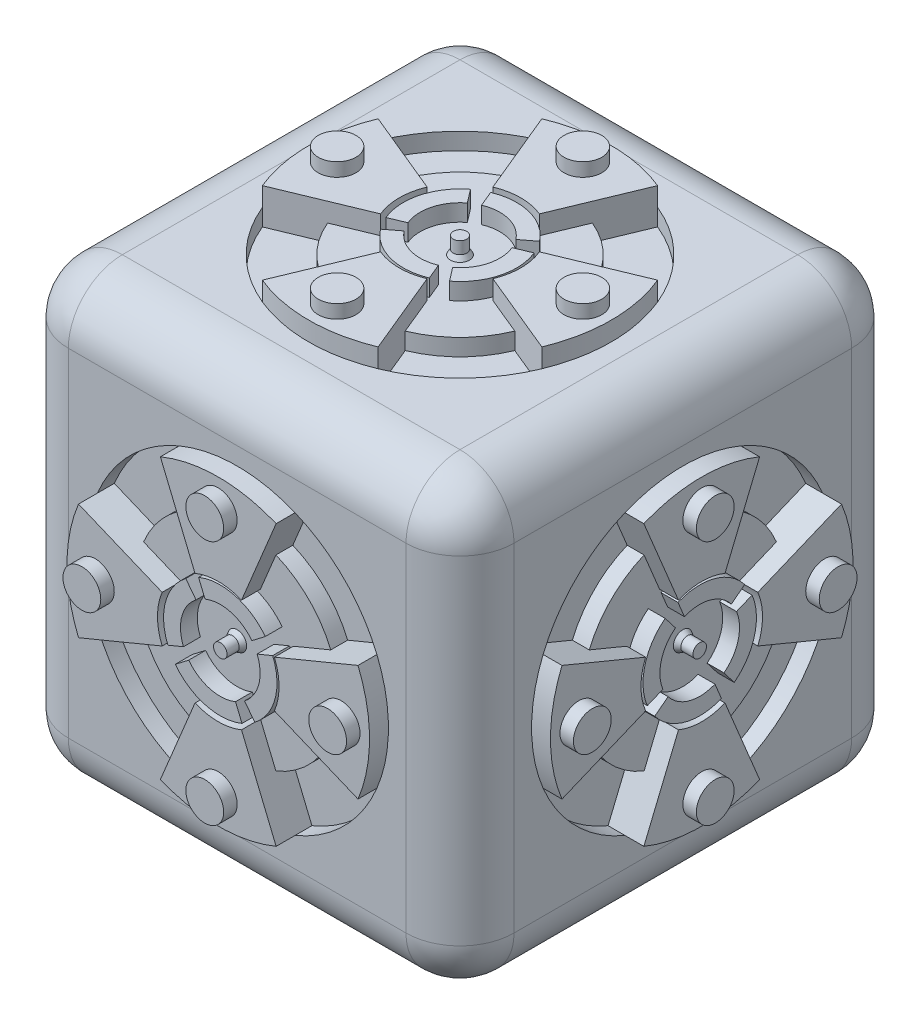
from build123d import *

# Parameters (mm, degrees)
SKETCH1_W                    = 41.91
SKETCH1_H                    = 41.91
BOSS_EXTRUDE1_DEPTH          = 20.955
FILLET1_R                    = 5.08
CUT_EXTRUDE1_DEPTH           = 1.5875
CIRPATTERN1_START            = -20.955
CIRPATTERN1_DEPTH            = 1.5875
BOSS_EXTRUDE2_START          = 1.778
BOSS_EXTRUDE2_DEPTH          = 1.778
CIRPATTERN2_COUNT            = 4
SKETCH4_R                    = 1.778
BOSS_EXTRUDE3_DEPTH          = 1.27
BOSS_EXTRUDE5_DEPTH          = 1.5875
CIRPATTERN3_COUNT            = 4
CIRPATTERN4_COUNT            = 4
CIRPATTERN4_START            = 1.778
CIRPATTERN4_COPY_1_DEPTH     = 1.778
CIRPATTERN4_COPY_2_DEPTH     = 1.778
CIRPATTERN4_COPY_3_DEPTH     = 1.778
CIRPATTERN4_COPY_4_DEPTH     = 1.778
CIRPATTERN4_COPY_5_DEPTH     = 1.778
CIRPATTERN4_COPY_6_DEPTH     = 1.778
CIRPATTERN4_COPY_7_DEPTH     = 1.778
CIRPATTERN4_COPY_8_DEPTH     = 1.778
CIRPATTERN4_COPY_9_DEPTH     = 1.778
CIRPATTERN4_COPY_10_SKETCH_R = 1.778
CIRPATTERN4_COPY_10_DEPTH    = 1.27
CIRPATTERN4_COPY_11_SKETCH_R = 1.778
CIRPATTERN4_COPY_11_DEPTH    = 1.27
CIRPATTERN4_COPY_12_SKETCH_R = 1.778
CIRPATTERN4_COPY_12_DEPTH    = 1.27
CIRPATTERN4_COPY_13_SKETCH_R = 1.778
CIRPATTERN4_COPY_13_DEPTH    = 1.27
CIRPATTERN4_COPY_14_SKETCH_R = 1.778
CIRPATTERN4_COPY_14_DEPTH    = 1.27
CIRPATTERN4_COPY_15_SKETCH_R = 1.778
CIRPATTERN4_COPY_15_DEPTH    = 1.27
CIRPATTERN4_COPY_16_SKETCH_R = 1.778
CIRPATTERN4_COPY_16_DEPTH    = 1.27
CIRPATTERN4_COPY_17_SKETCH_R = 1.778
CIRPATTERN4_COPY_17_DEPTH    = 1.27
CIRPATTERN4_COPY_18_SKETCH_R = 1.778
CIRPATTERN4_COPY_18_DEPTH    = 1.27
CIRPATTERN5_COUNT            = 4
CIRPATTERN5_START            = 1.778
CIRPATTERN5_COPY_1_DEPTH     = 1.778
CIRPATTERN5_COPY_2_DEPTH     = 1.778
CIRPATTERN5_COPY_3_DEPTH     = 1.778
CIRPATTERN5_COPY_4_DEPTH     = 1.778
CIRPATTERN5_COPY_5_DEPTH     = 1.778
CIRPATTERN5_COPY_6_DEPTH     = 1.778
CIRPATTERN5_COPY_7_SKETCH_R  = 1.778
CIRPATTERN5_COPY_7_DEPTH     = 1.27
CIRPATTERN5_COPY_8_SKETCH_R  = 1.778
CIRPATTERN5_COPY_8_DEPTH     = 1.27
CIRPATTERN5_COPY_9_SKETCH_R  = 1.778
CIRPATTERN5_COPY_9_DEPTH     = 1.27
CIRPATTERN5_COPY_10_SKETCH_R = 1.778
CIRPATTERN5_COPY_10_DEPTH    = 1.27
CIRPATTERN5_COPY_11_SKETCH_R = 1.778
CIRPATTERN5_COPY_11_DEPTH    = 1.27
CIRPATTERN5_COPY_12_SKETCH_R = 1.778
CIRPATTERN5_COPY_12_DEPTH    = 1.27


# Read off the part's stored shape, not the designer's step: CirPattern1
with BuildPart() as part:
    # Sketch1 → Boss-Extrude1 (new, symmetric)
    with BuildSketch(Plane(origin=(0, 0, 0), x_dir=(1, 0, 0), z_dir=(0, 1, 0))):
        Rectangle(SKETCH1_W, SKETCH1_H)
    extrude(amount=BOSS_EXTRUDE1_DEPTH, both=True)

    # Fillet1
    fillet1_edges = [part.edges().sort_by_distance(p)[0] for p in [
        (20.955, 20.955, 0),
        (0, 20.955, -20.955),
        (-20.955, 20.955, 0),
        (0, -20.955, -20.955),
        (20.955, -20.955, 0),
        (0, -20.955, 20.955),
        (-20.955, -20.955, 0),
        (0, 20.955, 20.955),
        (-20.955, 0, -20.955),
        (20.955, 0, -20.955),
        (20.955, 0, 20.955),
        (-20.955, 0, 20.955),
    ]]
    fillet(fillet1_edges, radius=FILLET1_R)

    # Sketch2 → Cut-Extrude1 (cut)
    with BuildSketch(Plane.XZ.offset(20.955)):
        with BuildLine():
            Line((3.645059693, 8.799952547), (5.443289142, 13.14126247))
            ThreePointArc((5.443289142, 13.14126247), (10.057886856, 10.057886856), (13.14126247, 5.443289142))
            Line((13.14126247, 5.443289142), (8.799952547, 3.645059693))
            ThreePointArc((8.799952547, 3.645059693), (6.735192091, 6.735192091), (3.645059693, 8.799952547))
        make_face()
    cut_extrude1 = extrude(amount=-CUT_EXTRUDE1_DEPTH, mode=Mode.SUBTRACT)

    # CirPattern1 outline → CirPattern1 (cut)
    with BuildSketch(Plane(origin=(0, 0, 0), x_dir=(1, 0, 0), z_dir=(0, 1, 0)).offset(CIRPATTERN1_START)):
        with BuildLine():
            Line((-5.443289142, -13.14126247), (-3.645059693, -8.799952547))
            ThreePointArc((-3.645059693, -8.799952547), (-6.735192091, -6.735192091), (-8.799952547, -3.645059693))
            Line((-8.799952547, -3.645059693), (-13.14126247, -5.443289142))
            ThreePointArc((-13.14126247, -5.443289142), (-10.057886856, -10.057886856), (-5.443289142, -13.14126247))
        make_face()
        with BuildLine():
            Line((-13.14126247, 5.443289142), (-8.799952547, 3.645059693))
            ThreePointArc((-8.799952547, 3.645059693), (-6.735192091, 6.735192091), (-3.645059693, 8.799952547))
            Line((-3.645059693, 8.799952547), (-5.443289142, 13.14126247))
            ThreePointArc((-5.443289142, 13.14126247), (-10.057886856, 10.057886856), (-13.14126247, 5.443289142))
        make_face()
        with BuildLine():
            Line((5.443289142, 13.14126247), (3.645059693, 8.799952547))
            ThreePointArc((3.645059693, 8.799952547), (6.735192091, 6.735192091), (8.799952547, 3.645059693))
            Line((8.799952547, 3.645059693), (13.14126247, 5.443289142))
            ThreePointArc((13.14126247, 5.443289142), (10.057886856, 10.057886856), (5.443289142, 13.14126247))
        make_face()
    cirpattern1 = extrude(amount=CIRPATTERN1_DEPTH, mode=Mode.SUBTRACT)

    # Sketch3 → Boss-Extrude2 (add)
    with BuildSketch(Plane.XZ.offset(20.955).offset(BOSS_EXTRUDE2_START)):
        with BuildLine():
            Line((-5.443289142, 13.14126247), (-2.187035816, 5.279971528))
            ThreePointArc((-2.187035816, 5.279971528), (0, 5.715), (2.187035816, 5.279971528))
            Line((2.187035816, 5.279971528), (5.443289142, 13.14126247))
            ThreePointArc((5.443289142, 13.14126247), (0, 14.224), (-5.443289142, 13.14126247))
        make_face()
    boss_extrude2 = extrude(amount=-BOSS_EXTRUDE2_DEPTH)

    # CirPattern2: Boss-Extrude2 ×4 about axis
    cirpattern2_axis = Axis((0, 23.2029, 0), (0, -1, 0))
    for i in range(1, CIRPATTERN2_COUNT):
        add(boss_extrude2.rotate(cirpattern2_axis, i * 360 / CIRPATTERN2_COUNT))

    # Sketch4 → Boss-Extrude3 (add)
    with BuildSketch(Plane.XZ.offset(22.733)):
        with Locations(Location((0, 11.557, 0), (0, 0, 90))):
            Circle(SKETCH4_R)
    boss_extrude3 = extrude(amount=BOSS_EXTRUDE3_DEPTH)

    # Sketch7 → Revolve1 (revolve)
    with BuildSketch(Plane.XY, mode=Mode.PRIVATE) as revolve1_sk:
        Polygon((0, -20.955), (0.891632195, -20.955), (0.635, -21.3995), (0.635, -22.5425), (0, -22.5425), align=None)
    revolve1 = revolve(revolve1_sk.sketch.rotate(Axis((0, 23.2029, 0), (0, -1, 0)), 90), axis=Axis((0, 23.2029, 0), (0, -1, 0)))

    # Sketch8 → Boss-Extrude5 (add)
    with BuildSketch(Plane.XZ.offset(20.955)):
        with BuildLine():
            Line((4.231746717, 3.247133462), (2.972298289, 2.280724694))
            ThreePointArc((2.972298289, 2.280724694), (0.969665552, 3.618841108), (-1.433723479, 3.461314669))
            Line((-1.433723479, 3.461314669), (-2.041233428, 4.927973426))
            ThreePointArc((-2.041233428, 4.927973426), (1.380540787, 5.152248357), (4.231746717, 3.247133462))
        make_face()
        with BuildLine():
            Line((-3.247133462, 4.231746717), (-2.280724694, 2.972298289))
            ThreePointArc((-2.280724694, 2.972298289), (-3.618841108, 0.969665552), (-3.461314669, -1.433723479))
            Line((-3.461314669, -1.433723479), (-4.927973426, -2.041233428))
            ThreePointArc((-4.927973426, -2.041233428), (-5.152248357, 1.380540787), (-3.247133462, 4.231746717))
        make_face()
        with BuildLine():
            Line((-4.231746717, -3.247133462), (-2.972298289, -2.280724694))
            ThreePointArc((-2.972298289, -2.280724694), (-0.969665552, -3.618841108), (1.433723479, -3.461314669))
            Line((1.433723479, -3.461314669), (2.041233428, -4.927973426))
            ThreePointArc((2.041233428, -4.927973426), (-1.380540787, -5.152248357), (-4.231746717, -3.247133462))
        make_face()
        with BuildLine():
            Line((3.247133462, -4.231746717), (2.280724694, -2.972298289))
            ThreePointArc((2.280724694, -2.972298289), (3.618841108, -0.969665552), (3.461314669, 1.433723479))
            Line((3.461314669, 1.433723479), (4.927973426, 2.041233428))
            ThreePointArc((4.927973426, 2.041233428), (5.152248357, -1.380540787), (3.247133462, -4.231746717))
        make_face()
    boss_extrude5 = extrude(amount=BOSS_EXTRUDE5_DEPTH)

    # CirPattern3: Boss-Extrude3 ×4 about axis
    cirpattern3_axis = Axis((0, 0, 0), (0, 1, 0))
    for i in range(1, CIRPATTERN3_COUNT):
        add(boss_extrude3.rotate(cirpattern3_axis, i * 360 / CIRPATTERN3_COUNT))

    # CirPattern4: Cut-Extrude1, CirPattern1, Boss-Extrude2, Boss-Extrude3, Revolve1, Boss-Extrude5 ×4 about axis
    cirpattern4_axis = Axis((0, 0, 0), (1, 0, 0))
    add([cut_extrude1.rotate(cirpattern4_axis, i * 360 / CIRPATTERN4_COUNT) for i in range(1, CIRPATTERN4_COUNT)], mode=Mode.SUBTRACT)
    add([cirpattern1.rotate(cirpattern4_axis, i * 360 / CIRPATTERN4_COUNT) for i in range(1, CIRPATTERN4_COUNT)], mode=Mode.SUBTRACT)
    add([boss_extrude2.rotate(cirpattern4_axis, i * 360 / CIRPATTERN4_COUNT) for i in range(1, CIRPATTERN4_COUNT)])
    add([boss_extrude3.rotate(cirpattern4_axis, i * 360 / CIRPATTERN4_COUNT) for i in range(1, CIRPATTERN4_COUNT)])
    add([revolve1.rotate(cirpattern4_axis, i * 360 / CIRPATTERN4_COUNT) for i in range(1, CIRPATTERN4_COUNT)])
    add([boss_extrude5.rotate(cirpattern4_axis, i * 360 / CIRPATTERN4_COUNT) for i in range(1, CIRPATTERN4_COUNT)])

    # CirPattern4 copy 1 sketch → CirPattern4 copy 1 (add)
    with BuildSketch(Plane(origin=(0, 0, -20.955), x_dir=(0, -1, 0), z_dir=(0, 0, -1)).offset(CIRPATTERN4_START)):
        with BuildLine():
            Line((-5.443289142, 13.14126247), (-2.187035816, 5.279971528))
            ThreePointArc((-2.187035816, 5.279971528), (0, 5.715), (2.187035816, 5.279971528))
            Line((2.187035816, 5.279971528), (5.443289142, 13.14126247))
            ThreePointArc((5.443289142, 13.14126247), (0, 14.224), (-5.443289142, 13.14126247))
        make_face()
    extrude(amount=-CIRPATTERN4_COPY_1_DEPTH)

    # CirPattern4 copy 2 sketch → CirPattern4 copy 2 (add)
    with BuildSketch(Plane(origin=(0, 20.955, 0), x_dir=(0, 0, -1), z_dir=(0, 1, 0)).offset(CIRPATTERN4_START)):
        with BuildLine():
            Line((-5.443289142, 13.14126247), (-2.187035816, 5.279971528))
            ThreePointArc((-2.187035816, 5.279971528), (0, 5.715), (2.187035816, 5.279971528))
            Line((2.187035816, 5.279971528), (5.443289142, 13.14126247))
            ThreePointArc((5.443289142, 13.14126247), (0, 14.224), (-5.443289142, 13.14126247))
        make_face()
    extrude(amount=-CIRPATTERN4_COPY_2_DEPTH)

    # CirPattern4 copy 3 sketch → CirPattern4 copy 3 (add)
    with BuildSketch(Plane(origin=(0, 0, 20.955), x_dir=(0, 1, 0), z_dir=(0, 0, 1)).offset(CIRPATTERN4_START)):
        with BuildLine():
            Line((-5.443289142, 13.14126247), (-2.187035816, 5.279971528))
            ThreePointArc((-2.187035816, 5.279971528), (0, 5.715), (2.187035816, 5.279971528))
            Line((2.187035816, 5.279971528), (5.443289142, 13.14126247))
            ThreePointArc((5.443289142, 13.14126247), (0, 14.224), (-5.443289142, 13.14126247))
        make_face()
    extrude(amount=-CIRPATTERN4_COPY_3_DEPTH)

    # CirPattern4 copy 4 sketch → CirPattern4 copy 4 (add)
    with BuildSketch(Plane(origin=(0, 0, -20.955), x_dir=(-1, 0, 0), z_dir=(0, 0, -1)).offset(CIRPATTERN4_START)):
        with BuildLine():
            Line((-5.443289142, 13.14126247), (-2.187035816, 5.279971528))
            ThreePointArc((-2.187035816, 5.279971528), (0, 5.715), (2.187035816, 5.279971528))
            Line((2.187035816, 5.279971528), (5.443289142, 13.14126247))
            ThreePointArc((5.443289142, 13.14126247), (0, 14.224), (-5.443289142, 13.14126247))
        make_face()
    extrude(amount=-CIRPATTERN4_COPY_4_DEPTH)

    # CirPattern4 copy 5 sketch → CirPattern4 copy 5 (add)
    with BuildSketch(Plane(origin=(0, 20.955, 0), x_dir=(-1, 0, 0), z_dir=(0, 1, 0)).offset(CIRPATTERN4_START)):
        with BuildLine():
            Line((-5.443289142, 13.14126247), (-2.187035816, 5.279971528))
            ThreePointArc((-2.187035816, 5.279971528), (0, 5.715), (2.187035816, 5.279971528))
            Line((2.187035816, 5.279971528), (5.443289142, 13.14126247))
            ThreePointArc((5.443289142, 13.14126247), (0, 14.224), (-5.443289142, 13.14126247))
        make_face()
    extrude(amount=-CIRPATTERN4_COPY_5_DEPTH)

    # CirPattern4 copy 6 sketch → CirPattern4 copy 6 (add)
    with BuildSketch(Plane(origin=(0, 0, 20.955), x_dir=(-1, 0, 0), z_dir=(0, 0, 1)).offset(CIRPATTERN4_START)):
        with BuildLine():
            Line((-5.443289142, 13.14126247), (-2.187035816, 5.279971528))
            ThreePointArc((-2.187035816, 5.279971528), (0, 5.715), (2.187035816, 5.279971528))
            Line((2.187035816, 5.279971528), (5.443289142, 13.14126247))
            ThreePointArc((5.443289142, 13.14126247), (0, 14.224), (-5.443289142, 13.14126247))
        make_face()
    extrude(amount=-CIRPATTERN4_COPY_6_DEPTH)

    # CirPattern4 copy 7 sketch → CirPattern4 copy 7 (add)
    with BuildSketch(Plane.YX.offset(20.955).offset(CIRPATTERN4_START)):
        with BuildLine():
            Line((-5.443289142, 13.14126247), (-2.187035816, 5.279971528))
            ThreePointArc((-2.187035816, 5.279971528), (0, 5.715), (2.187035816, 5.279971528))
            Line((2.187035816, 5.279971528), (5.443289142, 13.14126247))
            ThreePointArc((5.443289142, 13.14126247), (0, 14.224), (-5.443289142, 13.14126247))
        make_face()
    extrude(amount=-CIRPATTERN4_COPY_7_DEPTH)

    # CirPattern4 copy 8 sketch → CirPattern4 copy 8 (add)
    with BuildSketch(Plane.ZX.offset(20.955).offset(CIRPATTERN4_START)):
        with BuildLine():
            Line((-5.443289142, 13.14126247), (-2.187035816, 5.279971528))
            ThreePointArc((-2.187035816, 5.279971528), (0, 5.715), (2.187035816, 5.279971528))
            Line((2.187035816, 5.279971528), (5.443289142, 13.14126247))
            ThreePointArc((5.443289142, 13.14126247), (0, 14.224), (-5.443289142, 13.14126247))
        make_face()
    extrude(amount=-CIRPATTERN4_COPY_8_DEPTH)

    # CirPattern4 copy 9 sketch → CirPattern4 copy 9 (add)
    with BuildSketch(Plane(origin=(0, 0, 20.955), x_dir=(0, -1, 0), z_dir=(0, 0, 1)).offset(CIRPATTERN4_START)):
        with BuildLine():
            Line((-5.443289142, 13.14126247), (-2.187035816, 5.279971528))
            ThreePointArc((-2.187035816, 5.279971528), (0, 5.715), (2.187035816, 5.279971528))
            Line((2.187035816, 5.279971528), (5.443289142, 13.14126247))
            ThreePointArc((5.443289142, 13.14126247), (0, 14.224), (-5.443289142, 13.14126247))
        make_face()
    extrude(amount=-CIRPATTERN4_COPY_9_DEPTH)

    # CirPattern4 copy 10 sketch → CirPattern4 copy 10 (add)
    with BuildSketch(Plane.YX.offset(22.733)):
        with Locations(Location((0, 11.557, 0), (0, 0, 90))):
            Circle(CIRPATTERN4_COPY_10_SKETCH_R)
    extrude(amount=CIRPATTERN4_COPY_10_DEPTH)

    # CirPattern4 copy 11 sketch → CirPattern4 copy 11 (add)
    with BuildSketch(Plane.ZX.offset(22.733)):
        with Locations(Location((0, 11.557, 0), (0, 0, 90))):
            Circle(CIRPATTERN4_COPY_11_SKETCH_R)
    extrude(amount=CIRPATTERN4_COPY_11_DEPTH)

    # CirPattern4 copy 12 sketch → CirPattern4 copy 12 (add)
    with BuildSketch(Plane(origin=(0, 0, 22.733), x_dir=(0, -1, 0), z_dir=(0, 0, 1))):
        with Locations(Location((0, 11.557, 0), (0, 0, 90))):
            Circle(CIRPATTERN4_COPY_12_SKETCH_R)
    extrude(amount=CIRPATTERN4_COPY_12_DEPTH)

    # CirPattern4 copy 13 sketch → CirPattern4 copy 13 (add)
    with BuildSketch(Plane(origin=(0, 0, -22.733), x_dir=(-1, 0, 0), z_dir=(0, 0, -1))):
        with Locations(Location((0, 11.557, 0), (0, 0, 90))):
            Circle(CIRPATTERN4_COPY_13_SKETCH_R)
    extrude(amount=CIRPATTERN4_COPY_13_DEPTH)

    # CirPattern4 copy 14 sketch → CirPattern4 copy 14 (add)
    with BuildSketch(Plane(origin=(0, 22.733, 0), x_dir=(-1, 0, 0), z_dir=(0, 1, 0))):
        with Locations(Location((0, 11.557, 0), (0, 0, 90))):
            Circle(CIRPATTERN4_COPY_14_SKETCH_R)
    extrude(amount=CIRPATTERN4_COPY_14_DEPTH)

    # CirPattern4 copy 15 sketch → CirPattern4 copy 15 (add)
    with BuildSketch(Plane(origin=(0, 0, 22.733), x_dir=(-1, 0, 0), z_dir=(0, 0, 1))):
        with Locations(Location((0, 11.557, 0), (0, 0, 90))):
            Circle(CIRPATTERN4_COPY_15_SKETCH_R)
    extrude(amount=CIRPATTERN4_COPY_15_DEPTH)

    # CirPattern4 copy 16 sketch → CirPattern4 copy 16 (add)
    with BuildSketch(Plane(origin=(0, 0, -22.733), x_dir=(0, -1, 0), z_dir=(0, 0, -1))):
        with Locations(Location((0, 11.557, 0), (0, 0, 90))):
            Circle(CIRPATTERN4_COPY_16_SKETCH_R)
    extrude(amount=CIRPATTERN4_COPY_16_DEPTH)

    # CirPattern4 copy 17 sketch → CirPattern4 copy 17 (add)
    with BuildSketch(Plane(origin=(0, 22.733, 0), x_dir=(0, 0, -1), z_dir=(0, 1, 0))):
        with Locations(Location((0, 11.557, 0), (0, 0, 90))):
            Circle(CIRPATTERN4_COPY_17_SKETCH_R)
    extrude(amount=CIRPATTERN4_COPY_17_DEPTH)

    # CirPattern4 copy 18 sketch → CirPattern4 copy 18 (add)
    with BuildSketch(Plane(origin=(0, 0, 22.733), x_dir=(0, 1, 0), z_dir=(0, 0, 1))):
        with Locations(Location((0, 11.557, 0), (0, 0, 90))):
            Circle(CIRPATTERN4_COPY_18_SKETCH_R)
    extrude(amount=CIRPATTERN4_COPY_18_DEPTH)

    # CirPattern5: Cut-Extrude1, CirPattern1, Boss-Extrude2, Boss-Extrude3, Revolve1, Boss-Extrude5 ×4 about axis, 1 skipped
    cirpattern5_axis = Axis((0, 0, 0), (0, 0, 1))
    add([cut_extrude1.rotate(cirpattern5_axis, i * 360 / CIRPATTERN5_COUNT) for i in range(1, CIRPATTERN5_COUNT) if i not in (2,)], mode=Mode.SUBTRACT)
    add([cirpattern1.rotate(cirpattern5_axis, i * 360 / CIRPATTERN5_COUNT) for i in range(1, CIRPATTERN5_COUNT) if i not in (2,)], mode=Mode.SUBTRACT)
    add([boss_extrude2.rotate(cirpattern5_axis, i * 360 / CIRPATTERN5_COUNT) for i in range(1, CIRPATTERN5_COUNT) if i not in (2,)])
    add([boss_extrude3.rotate(cirpattern5_axis, i * 360 / CIRPATTERN5_COUNT) for i in range(1, CIRPATTERN5_COUNT) if i not in (2,)])
    add([revolve1.rotate(cirpattern5_axis, i * 360 / CIRPATTERN5_COUNT) for i in range(1, CIRPATTERN5_COUNT) if i not in (2,)])
    add([boss_extrude5.rotate(cirpattern5_axis, i * 360 / CIRPATTERN5_COUNT) for i in range(1, CIRPATTERN5_COUNT) if i not in (2,)])

    # CirPattern5 copy 1 sketch → CirPattern5 copy 1 (add)
    with BuildSketch(Plane(origin=(20.955, 0, 0), x_dir=(0, 0, 1), z_dir=(1, 0, 0)).offset(CIRPATTERN5_START)):
        with BuildLine():
            Line((-5.443289142, 13.14126247), (-2.187035816, 5.279971528))
            ThreePointArc((-2.187035816, 5.279971528), (0, 5.715), (2.187035816, 5.279971528))
            Line((2.187035816, 5.279971528), (5.443289142, 13.14126247))
            ThreePointArc((5.443289142, 13.14126247), (0, 14.224), (-5.443289142, 13.14126247))
        make_face()
    extrude(amount=-CIRPATTERN5_COPY_1_DEPTH)

    # CirPattern5 copy 2 sketch → CirPattern5 copy 2 (add)
    with BuildSketch(Plane.ZY.offset(20.955).offset(CIRPATTERN5_START)):
        with BuildLine():
            Line((-5.443289142, 13.14126247), (-2.187035816, 5.279971528))
            ThreePointArc((-2.187035816, 5.279971528), (0, 5.715), (2.187035816, 5.279971528))
            Line((2.187035816, 5.279971528), (5.443289142, 13.14126247))
            ThreePointArc((5.443289142, 13.14126247), (0, 14.224), (-5.443289142, 13.14126247))
        make_face()
    extrude(amount=-CIRPATTERN5_COPY_2_DEPTH)

    # CirPattern5 copy 3 sketch → CirPattern5 copy 3 (add)
    with BuildSketch(Plane(origin=(20.955, 0, 0), x_dir=(0, -1, 0), z_dir=(1, 0, 0)).offset(CIRPATTERN5_START)):
        with BuildLine():
            Line((-5.443289142, 13.14126247), (-2.187035816, 5.279971528))
            ThreePointArc((-2.187035816, 5.279971528), (0, 5.715), (2.187035816, 5.279971528))
            Line((2.187035816, 5.279971528), (5.443289142, 13.14126247))
            ThreePointArc((5.443289142, 13.14126247), (0, 14.224), (-5.443289142, 13.14126247))
        make_face()
    extrude(amount=-CIRPATTERN5_COPY_3_DEPTH)

    # CirPattern5 copy 4 sketch → CirPattern5 copy 4 (add)
    with BuildSketch(Plane(origin=(-20.955, 0, 0), x_dir=(0, 1, 0), z_dir=(-1, 0, 0)).offset(CIRPATTERN5_START)):
        with BuildLine():
            Line((-5.443289142, 13.14126247), (-2.187035816, 5.279971528))
            ThreePointArc((-2.187035816, 5.279971528), (0, 5.715), (2.187035816, 5.279971528))
            Line((2.187035816, 5.279971528), (5.443289142, 13.14126247))
            ThreePointArc((5.443289142, 13.14126247), (0, 14.224), (-5.443289142, 13.14126247))
        make_face()
    extrude(amount=-CIRPATTERN5_COPY_4_DEPTH)

    # CirPattern5 copy 5 sketch → CirPattern5 copy 5 (add)
    with BuildSketch(Plane(origin=(20.955, 0, 0), x_dir=(0, 0, -1), z_dir=(1, 0, 0)).offset(CIRPATTERN5_START)):
        with BuildLine():
            Line((-5.443289142, 13.14126247), (-2.187035816, 5.279971528))
            ThreePointArc((-2.187035816, 5.279971528), (0, 5.715), (2.187035816, 5.279971528))
            Line((2.187035816, 5.279971528), (5.443289142, 13.14126247))
            ThreePointArc((5.443289142, 13.14126247), (0, 14.224), (-5.443289142, 13.14126247))
        make_face()
    extrude(amount=-CIRPATTERN5_COPY_5_DEPTH)

    # CirPattern5 copy 6 sketch → CirPattern5 copy 6 (add)
    with BuildSketch(Plane(origin=(-20.955, 0, 0), x_dir=(0, 0, -1), z_dir=(-1, 0, 0)).offset(CIRPATTERN5_START)):
        with BuildLine():
            Line((-5.443289142, 13.14126247), (-2.187035816, 5.279971528))
            ThreePointArc((-2.187035816, 5.279971528), (0, 5.715), (2.187035816, 5.279971528))
            Line((2.187035816, 5.279971528), (5.443289142, 13.14126247))
            ThreePointArc((5.443289142, 13.14126247), (0, 14.224), (-5.443289142, 13.14126247))
        make_face()
    extrude(amount=-CIRPATTERN5_COPY_6_DEPTH)

    # CirPattern5 copy 7 sketch → CirPattern5 copy 7 (add)
    with BuildSketch(Plane(origin=(22.733, 0, 0), x_dir=(0, 0, -1), z_dir=(1, 0, 0))):
        with Locations(Location((0, 11.557, 0), (0, 0, 90))):
            Circle(CIRPATTERN5_COPY_7_SKETCH_R)
    extrude(amount=CIRPATTERN5_COPY_7_DEPTH)

    # CirPattern5 copy 8 sketch → CirPattern5 copy 8 (add)
    with BuildSketch(Plane(origin=(-22.733, 0, 0), x_dir=(0, 0, -1), z_dir=(-1, 0, 0))):
        with Locations(Location((0, 11.557, 0), (0, 0, 90))):
            Circle(CIRPATTERN5_COPY_8_SKETCH_R)
    extrude(amount=CIRPATTERN5_COPY_8_DEPTH)

    # CirPattern5 copy 9 sketch → CirPattern5 copy 9 (add)
    with BuildSketch(Plane(origin=(22.733, 0, 0), x_dir=(0, -1, 0), z_dir=(1, 0, 0))):
        with Locations(Location((0, 11.557, 0), (0, 0, 90))):
            Circle(CIRPATTERN5_COPY_9_SKETCH_R)
    extrude(amount=CIRPATTERN5_COPY_9_DEPTH)

    # CirPattern5 copy 10 sketch → CirPattern5 copy 10 (add)
    with BuildSketch(Plane(origin=(-22.733, 0, 0), x_dir=(0, 1, 0), z_dir=(-1, 0, 0))):
        with Locations(Location((0, 11.557, 0), (0, 0, 90))):
            Circle(CIRPATTERN5_COPY_10_SKETCH_R)
    extrude(amount=CIRPATTERN5_COPY_10_DEPTH)

    # CirPattern5 copy 11 sketch → CirPattern5 copy 11 (add)
    with BuildSketch(Plane(origin=(22.733, 0, 0), x_dir=(0, 0, 1), z_dir=(1, 0, 0))):
        with Locations(Location((0, 11.557, 0), (0, 0, 90))):
            Circle(CIRPATTERN5_COPY_11_SKETCH_R)
    extrude(amount=CIRPATTERN5_COPY_11_DEPTH)

    # CirPattern5 copy 12 sketch → CirPattern5 copy 12 (add)
    with BuildSketch(Plane.ZY.offset(22.733)):
        with Locations(Location((0, 11.557, 0), (0, 0, 90))):
            Circle(CIRPATTERN5_COPY_12_SKETCH_R)
    extrude(amount=CIRPATTERN5_COPY_12_DEPTH)


solid = part.part
